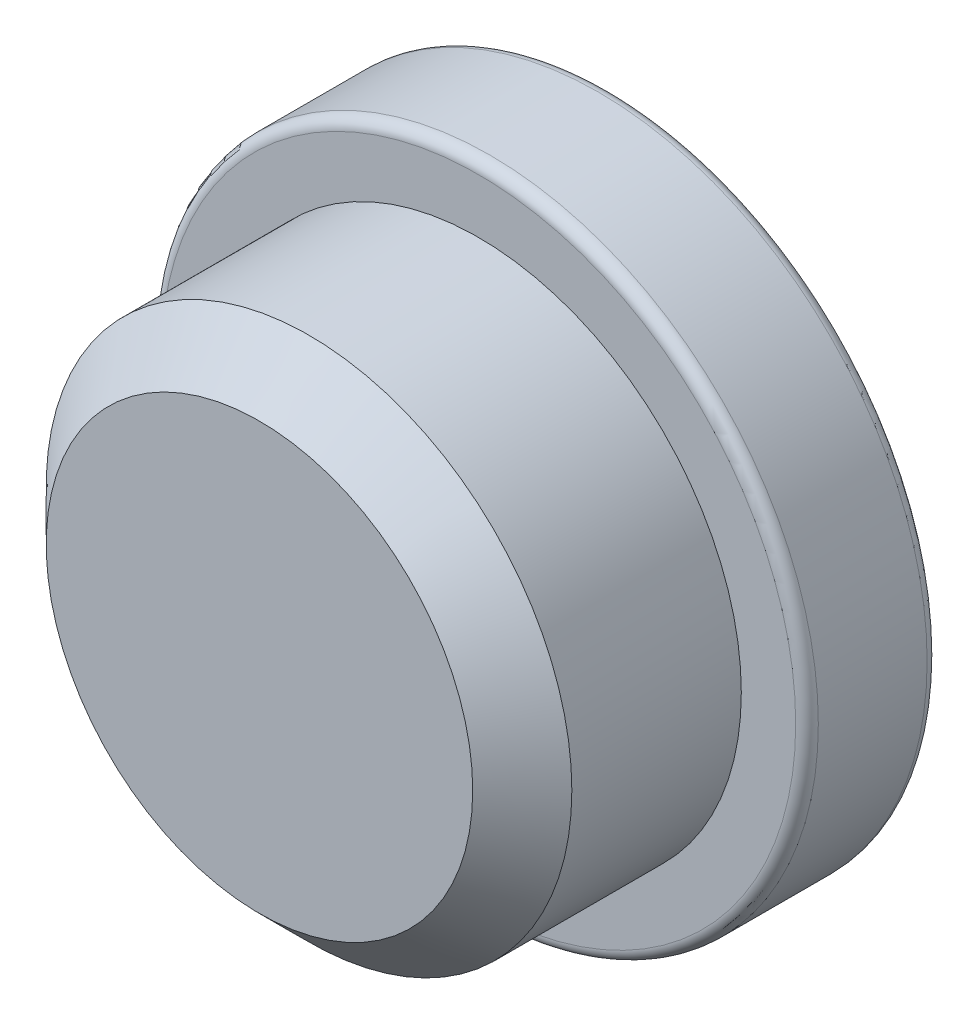
from build123d import *

# Parameters (mm, degrees)
FILLET1_R          = 0.20483871
SKETCH2_W          = 1.5875
SKETCH2_H          = 9.525
CUT_EXTRUDE1_DEPTH = 0.396875
CHAMFER1_SIZE      = 0.79375
CHAMFER1_SIZE_2    = 1.374815329


with BuildPart() as part:
    # Sketch1 → Revolve1 (revolve)
    with BuildSketch(Plane(origin=(0, 0, 0), x_dir=(1, 0, 0), z_dir=(0, 1, 0))):
        Polygon((0, 6.35), (5.953125, 6.35), (5.953125, 3.96875), (4.7625, 3.96875), (4.7625, 0.898025612), (3.864474388, 0), (0, 0), align=None)
    revolve(axis=Axis((0, 0, 0), (0, 0, -1)))

    # Fillet1
    fillet1_edges = [part.edges().sort_by_distance(p)[0] for p in [
        (-5.953125, 0, -3.96875),
        (-5.953125, 0, -6.35),
    ]]
    fillet(fillet1_edges, radius=FILLET1_R)

    # Sketch2 → Cut-Extrude1 (cut)
    with BuildSketch(Plane(origin=(0, 0, -6.35), x_dir=(-1, 0, 0), z_dir=(0, 0, -1))):
        Rectangle(SKETCH2_W, SKETCH2_H)
    extrude(amount=-CUT_EXTRUDE1_DEPTH, mode=Mode.SUBTRACT)

    # Chamfer1
    # the kernel refuses this chamfer: 1.374815329, 0.79375 mm, written as the material it adds along each edge
    with BuildSketch(Plane(origin=(-0.79375, -4.7625, -5.953125), x_dir=(0, -0.057893862402671005, -0.9983227437537926), z_dir=(1, 0, 0))) as chamfer1_piece_1_section:
        Polygon((CHAMFER1_SIZE * 0.998322743754, CHAMFER1_SIZE * 0.0578938624027), (-CHAMFER1_SIZE_2 * 0.0578938623819, CHAMFER1_SIZE_2 * 0.998322743396), (0, 0), align=None)
    chamfer1_piece_1 = extrude(amount=1.5875, mode=Mode.PRIVATE)
    chamfer1_piece_1 = split(chamfer1_piece_1, bisect_by=Plane(origin=(0, -4.227849594, -6.35), z_dir=(0, 0, 1)), keep=Keep.TOP, mode=Mode.PRIVATE)
    add(chamfer1_piece_1)
    with BuildSketch(Plane(origin=(0.79375, 4.7625, -5.953125), x_dir=(0, 0.057893862402671005, -0.9983227437537926), z_dir=(-1, 0, 0))) as chamfer1_piece_2_section:
        Polygon((CHAMFER1_SIZE * 0.998322743754, CHAMFER1_SIZE * 0.0578938624027), (-CHAMFER1_SIZE_2 * 0.0578938623819, CHAMFER1_SIZE_2 * 0.998322743396), (0, 0), align=None)
    chamfer1_piece_2 = extrude(amount=1.5875, mode=Mode.PRIVATE)
    chamfer1_piece_2 = split(chamfer1_piece_2, bisect_by=Plane(origin=(0, 4.227849594, -6.35), z_dir=(0, 0, 1)), keep=Keep.TOP, mode=Mode.PRIVATE)
    add(chamfer1_piece_2)


solid = part.part
